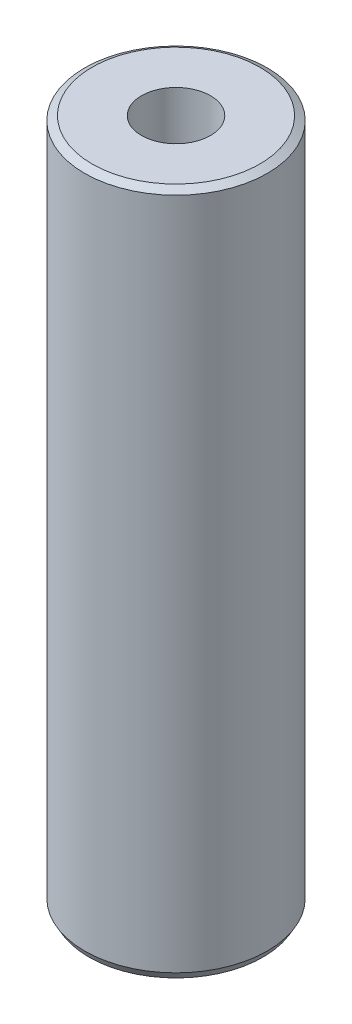
from build123d import *
from OCP.BRepFilletAPI import BRepFilletAPI_MakeChamfer

# Parameters (mm, degrees)
SKETCH1_R           = 60
BOSS_EXTRUDE1_DEPTH = 449.970885556
SKETCH2_R           = 22.655831697
CUT_EXTRUDE1_DEPTH  = 458.901515447
CHAMFER1_SIZE       = 2.844856022
CHAMFER1_SIZE2      = 4.92743517


with BuildPart() as part:
    # Sketch1 → Boss-Extrude1 (new body)
    with BuildSketch(Plane(origin=(0, 0, 0), x_dir=(1, 0, 0), z_dir=(0, 1, 0))):
        Circle(SKETCH1_R)
    extrude(amount=BOSS_EXTRUDE1_DEPTH)

    # Sketch2 → Cut-Extrude1 (cut, through all)
    with BuildSketch(Plane(origin=(0, 0, 0), x_dir=(1, 0, 0), z_dir=(0, 1, 0))):
        Circle(SKETCH2_R)
    extrude(amount=CUT_EXTRUDE1_DEPTH, mode=Mode.SUBTRACT)

    # Chamfer1: one chamfer whose edges measure the first distance from different faces: ONE call of the kernel's chamfer builder (chamfer() names one face for all edges)
    chamfer1_edges_1 = [part.edges().sort_by_distance(p)[0] for p in [
        (-60, 449.970885556, 0),
    ]]
    chamfer1_side_1 = [part.faces().sort_by_distance(p)[0] for p in [
        (-60, 224.985442778, 0),
    ]]
    chamfer1_edges_2 = [part.edges().sort_by_distance(p)[0] for p in [
        (-60, 0, 0),
    ]]
    chamfer1_side_2 = [part.faces().sort_by_distance(p)[0] for p in [
        (-58.302943725, 0, 0),
    ]]
    chamfer1 = BRepFilletAPI_MakeChamfer(part.part.solid().wrapped)
    for e in chamfer1_edges_1:
        chamfer1.Add(CHAMFER1_SIZE, CHAMFER1_SIZE2, e.wrapped, chamfer1_side_1[0].wrapped)  # the first distance lies on this face
    for e in chamfer1_edges_2:
        chamfer1.Add(CHAMFER1_SIZE, CHAMFER1_SIZE2, e.wrapped, chamfer1_side_2[0].wrapped)  # the first distance lies on this face
    add(Compound.cast(chamfer1.Shape()), mode=Mode.REPLACE)


solid = part.part
